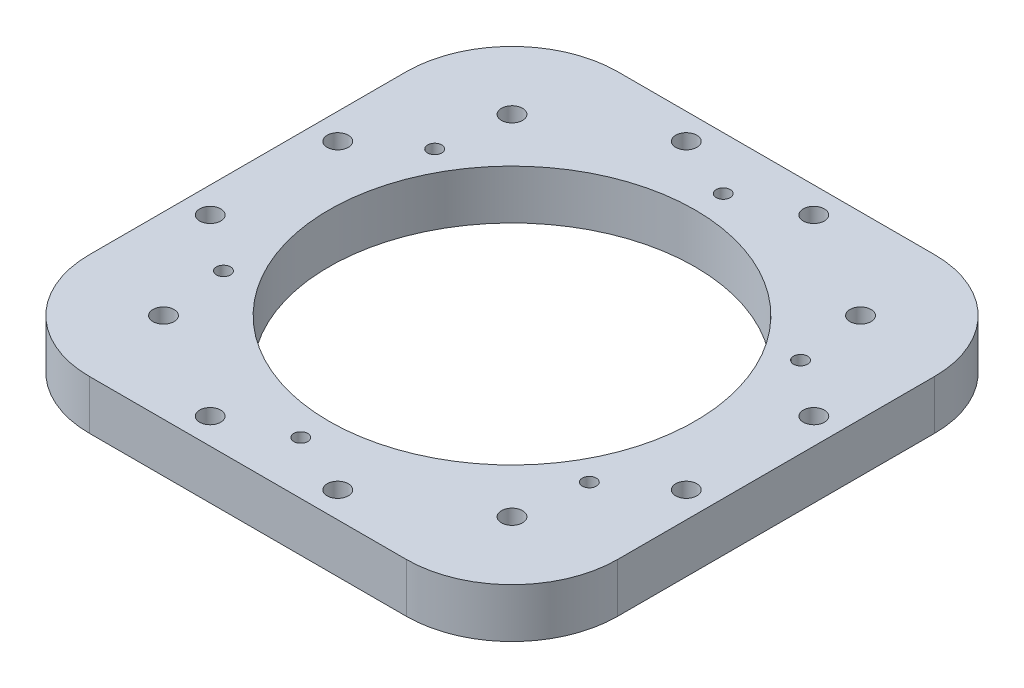
from build123d import *

# Parameters (mm, degrees)
SKETCH1_W           = 75
SKETCH1_H           = 75
SKETCH1_R           = 26
SKETCH1_R_2         = 1
SKETCH1_R_3         = 1.5
BOSS_EXTRUDE1_DEPTH = 7
FILLET1_R           = 15


with BuildPart() as part:
    # Sketch1 → Boss-Extrude1 (new body)
    with BuildSketch(Plane(origin=(0, 0, 0), x_dir=(1, 0, 0), z_dir=(0, 1, 0))):
        Rectangle(SKETCH1_W, SKETCH1_H)
        Circle(SKETCH1_R, mode=Mode.SUBTRACT)
        with Locations((0, 30)):
            Circle(SKETCH1_R_2, mode=Mode.SUBTRACT)
        with Locations((25.980762114, 15)):
            Circle(SKETCH1_R_2, mode=Mode.SUBTRACT)
        with Locations((25.980762114, -15)):
            Circle(SKETCH1_R_2, mode=Mode.SUBTRACT)
        with Locations((0, -30)):
            Circle(SKETCH1_R_2, mode=Mode.SUBTRACT)
        with Locations((-25.980762114, -15)):
            Circle(SKETCH1_R_2, mode=Mode.SUBTRACT)
        with Locations((-25.980762114, 15)):
            Circle(SKETCH1_R_2, mode=Mode.SUBTRACT)
        with Locations((-33.80740392, -9.058666579)):
            Circle(SKETCH1_R_3, mode=Mode.SUBTRACT)
        with Locations((-33.80740392, 9.058666579)):
            Circle(SKETCH1_R_3, mode=Mode.SUBTRACT)
        with Locations((-24.748737342, 24.748737342)):
            Circle(SKETCH1_R_3, mode=Mode.SUBTRACT)
        with Locations((-9.058666579, 33.80740392)):
            Circle(SKETCH1_R_3, mode=Mode.SUBTRACT)
        with Locations((9.058666579, 33.80740392)):
            Circle(SKETCH1_R_3, mode=Mode.SUBTRACT)
        with Locations((24.748737342, 24.748737342)):
            Circle(SKETCH1_R_3, mode=Mode.SUBTRACT)
        with Locations((33.80740392, 9.058666579)):
            Circle(SKETCH1_R_3, mode=Mode.SUBTRACT)
        with Locations((33.80740392, -9.058666579)):
            Circle(SKETCH1_R_3, mode=Mode.SUBTRACT)
        with Locations((24.748737342, -24.748737342)):
            Circle(SKETCH1_R_3, mode=Mode.SUBTRACT)
        with Locations((9.058666579, -33.80740392)):
            Circle(SKETCH1_R_3, mode=Mode.SUBTRACT)
        with Locations((-9.058666579, -33.80740392)):
            Circle(SKETCH1_R_3, mode=Mode.SUBTRACT)
        with Locations((-24.748737342, -24.748737342)):
            Circle(SKETCH1_R_3, mode=Mode.SUBTRACT)
    extrude(amount=BOSS_EXTRUDE1_DEPTH)

    # Fillet1
    fillet1_edges = [part.edges().sort_by_distance(p)[0] for p in [
        (-37.5, 3.5, -37.5),
        (-37.5, 3.5, 37.5),
        (37.5, 3.5, 37.5),
        (37.5, 3.5, -37.5),
    ]]
    fillet(fillet1_edges, radius=FILLET1_R)


solid = part.part
